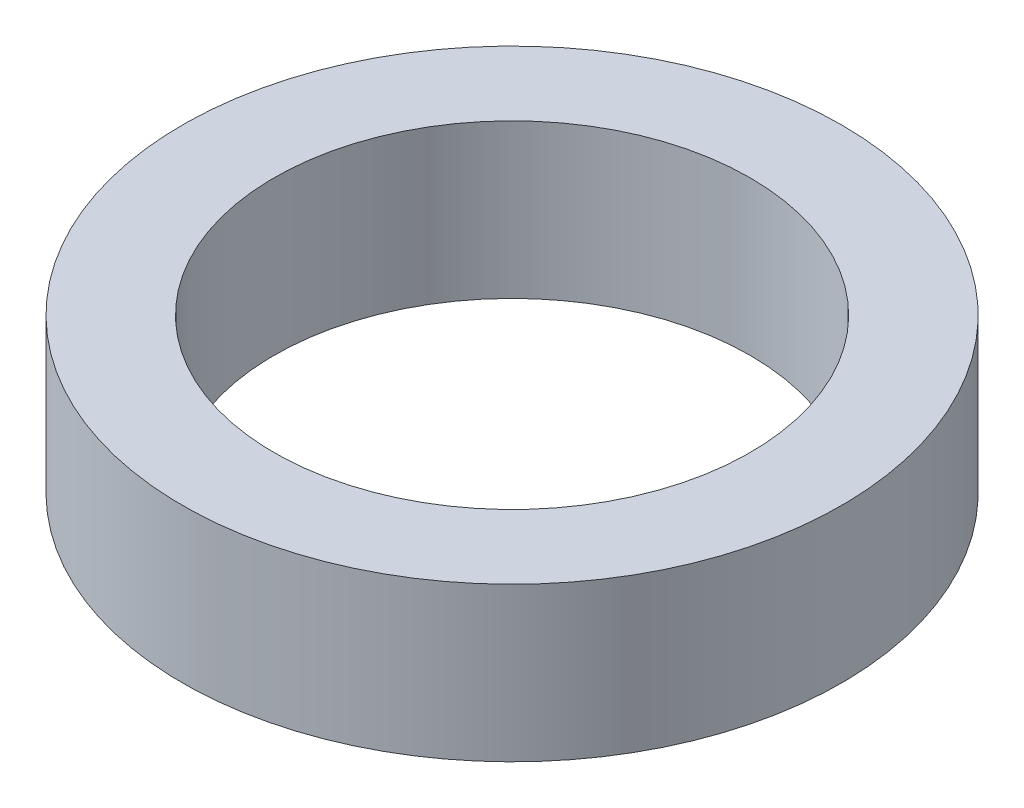
from build123d import *

# Parameters (mm, degrees)
SKETCH1_R           = 45
BOSS_EXTRUDE1_DEPTH = 21
SKETCH2_R           = 32.5
CUT_EXTRUDE1_DEPTH  = 68.014923711


with BuildPart() as part:
    # Sketch1 → Boss-Extrude1 (new body)
    with BuildSketch(Plane(origin=(0, 0, 0), x_dir=(1, 0, 0), z_dir=(0, 1, 0))):
        Circle(SKETCH1_R)
    extrude(amount=BOSS_EXTRUDE1_DEPTH)

    # Sketch2 → Cut-Extrude1 (cut, through all)
    with BuildSketch(Plane(origin=(0, 0, 0), x_dir=(1, 0, 0), z_dir=(0, 1, 0))):
        Circle(SKETCH2_R)
    extrude(amount=CUT_EXTRUDE1_DEPTH, mode=Mode.SUBTRACT)


solid = part.part
